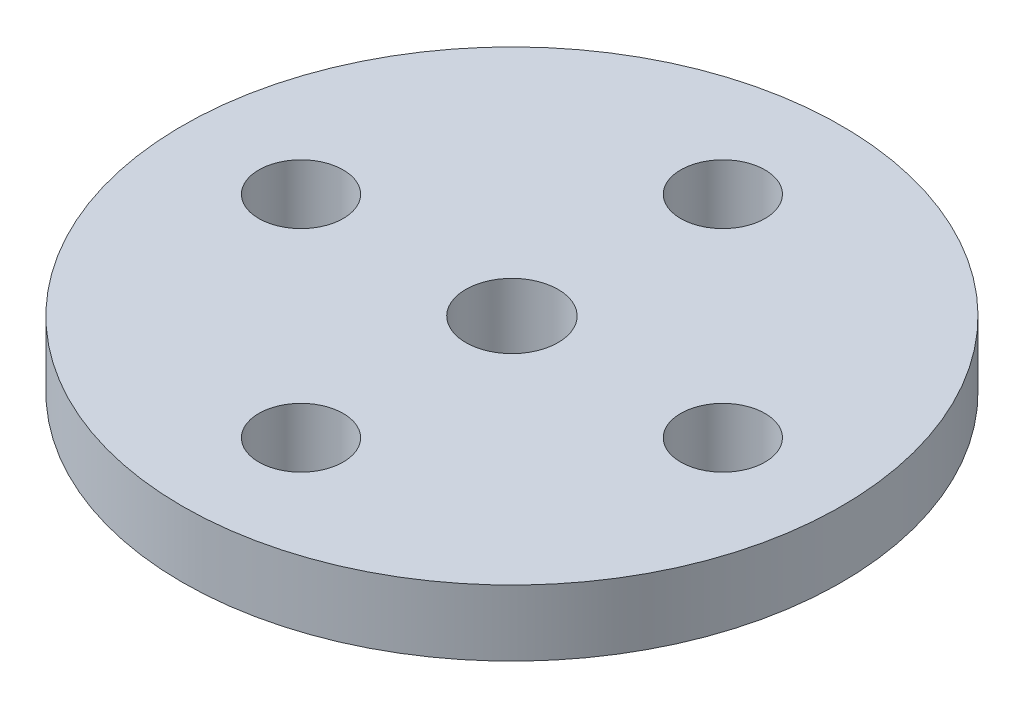
from build123d import *
from build123d.topology import SkipClean

# Parameters (mm, degrees)
CUT_EXTRUDE1_START         = -4.5
CUT_EXTRUDE1_OUTLINE_R     = 6.99
CUT_EXTRUDE1_OUTLINE_R_2   = 3.43154
CUT_EXTRUDE1_DEPTH         = 4.5
CUT_EXTRUDE1_2_OUTLINE_R   = 3.43154
CUT_EXTRUDE1_2_DEPTH       = 2.9
CUT_EXTRUDE1_START_2       = -1.1
CUT_EXTRUDE1_3_OUTLINE_R   = 3.43154
CUT_EXTRUDE1_3_OUTLINE_R_2 = 1.5
CUT_EXTRUDE1_3_DEPTH       = 1.1
SKETCH3_R                  = 1.6
CUT_EXTRUDE2_DEPTH         = 10
SKETCH3_3_R                = 12.5
SKETCH3_3_R_2              = 1.6
BOSS_EXTRUDE1_DEPTH        = 2.5
SKETCH4_R                  = 3
CUT_EXTRUDE3_DEPTH         = 2
SKETCH5_R                  = 1.75
CUT_EXTRUDE4_DEPTH         = 19.241436347
BOSS_EXTRUDE2_START        = 1.5
BOSS_EXTRUDE2_DEPTH        = 1.5
CUT_EXTRUDE5_DEPTH         = 3.5


with BuildPart() as part:
    # Cut-Extrude1: read off the stored shape, not the designer's step
    # Cut-Extrude1 outline → Cut-Extrude1 (new body)
    with BuildSketch(Plane(origin=(0, 4.5, 0), x_dir=(1, 0, 0), z_dir=(0, 1, 0)).offset(CUT_EXTRUDE1_START)):
        Circle(CUT_EXTRUDE1_OUTLINE_R)
        Circle(CUT_EXTRUDE1_OUTLINE_R_2, mode=Mode.SUBTRACT)
    extrude(amount=CUT_EXTRUDE1_DEPTH)

    # Cut-Extrude1 2 outline → Cut-Extrude1 2 (add)
    with BuildSketch(Plane(origin=(0, 4.5, 0), x_dir=(1, 0, 0), z_dir=(0, 1, 0)).offset(CUT_EXTRUDE1_START)):
        Circle(CUT_EXTRUDE1_2_OUTLINE_R)
        with BuildLine():
            ThreePointArc((-2.053246938, -1.675314004), (-2.115398038, -1.596117521), (-2.174496205, -1.514617527))
            Line((-2.174496205, -1.514617527), (-2.614150746, -1.571214778))
            ThreePointArc((-2.614150746, -1.571214778), (-2.645747318, -1.517406053), (-2.676236467, -1.462962191))
            Line((-2.676236467, -1.462962191), (-2.405374061, -1.112059184))
            ThreePointArc((-2.405374061, -1.112059184), (-2.445877205, -1.019894454), (-2.48285047, -0.926257816))
            Line((-2.48285047, -0.926257816), (-2.922767619, -0.871739323))
            ThreePointArc((-2.922767619, -0.871739323), (-2.939989841, -0.81176335), (-2.955981479, -0.751447599))
            Line((-2.955981479, -0.751447599), (-2.606362684, -0.478929596))
            ThreePointArc((-2.606362684, -0.478929596), (-2.622672912, -0.379587668), (-2.635198109, -0.27969792))
            Line((-2.635198109, -0.27969792), (-3.047736253, -0.11748928))
            ThreePointArc((-3.047736253, -0.11748928), (-3.04950199, -0.05511457), (-3.049991304, 0.00728321))
            Line((-3.049991304, 0.00728321), (-2.643583955, 0.1842929))
            ThreePointArc((-2.643583955, 0.1842929), (-2.634676434, 0.284570008), (-2.621966559, 0.384436425))
            Line((-2.621966559, 0.384436425), (-2.98120441, 0.644143047))
            ThreePointArc((-2.98120441, 0.644143047), (-2.967402713, 0.704997262), (-2.952358958, 0.765556388))
            Line((-2.952358958, 0.765556388), (-2.514699123, 0.835935595))
            ThreePointArc((-2.514699123, 0.835935595), (-2.481133546, 0.930847102), (-2.443987207, 1.024415215))
            Line((-2.443987207, 1.024415215), (-2.72735253, 1.365301497))
            ThreePointArc((-2.72735253, 1.365301497), (-2.698850611, 1.420811522), (-2.669219041, 1.475726842))
            Line((-2.669219041, 1.475726842), (-2.227806497, 1.435053382))
            ThreePointArc((-2.227806497, 1.435053382), (-2.171691912, 1.51863565), (-2.11244315, 1.60002623))
            Line((-2.11244315, 1.60002623), (-2.30213106, 2.000673033))
            ThreePointArc((-2.30213106, 2.000673033), (-2.260719799, 2.04735097), (-2.218362274, 2.093171952))
            Line((-2.218362274, 2.093171952), (-1.800932596, 1.944001488))
            ThreePointArc((-1.800932596, 1.944001488), (-1.725794889, 2.011002735), (-1.648166522, 2.075101712))
            Line((-1.648166522, 2.075101712), (-1.732258228, 2.510334924))
            ThreePointArc((-1.732258228, 2.510334924), (-1.680539647, 2.545247826), (-1.628117647, 2.57909537))
            Line((-1.628117647, 2.57909537), (-1.260899476, 2.33080083))
            ThreePointArc((-1.260899476, 2.33080083), (-1.171459825, 2.377011123), (-1.080329529, 2.419790923))
            Line((-1.080329529, 2.419790923), (-1.053541242, 2.862263239))
            ThreePointArc((-1.053541242, 2.862263239), (-0.99476501, 2.8832174), (-0.935572401, 2.90296474))
            Line((-0.935572401, 2.90296474), (-0.641639405, 2.571147385))
            ThreePointArc((-0.641639405, 2.571147385), (-0.543517633, 2.593663159), (-0.444611459, 2.61243577))
            Line((-0.444611459, 2.61243577), (-0.308626384, 3.034345029))
            ThreePointArc((-0.308626384, 3.034345029), (-0.246485627, 3.040023822), (-0.1842417, 3.044430159))
            Line((-0.1842417, 3.044430159), (0.01793723, 2.649939293))
            ThreePointArc((0.01793723, 2.649939293), (0.118575771, 2.6473458), (0.219043185, 2.64093167))
            Line((0.219043185, 2.64093167), (0.455680604, 3.015767761))
            ThreePointArc((0.455680604, 3.015767761), (0.517281353, 3.005814366), (0.578665585, 2.994602835))
            Line((0.578665585, 2.994602835), (0.676386803, 2.562225769))
            ThreePointArc((0.676386803, 2.562225769), (0.773218624, 2.534685969), (0.868934539, 2.50348812))
            Line((0.868934539, 2.50348812), (1.191355504, 2.807698713))
            ThreePointArc((1.191355504, 2.807698713), (1.248545643, 2.782738539), (1.305213182, 2.756613602))
            Line((1.305213182, 2.756613602), (1.292336505, 2.313518178))
            ThreePointArc((1.292336505, 2.313518178), (1.379277306, 2.262762496), (1.464227541, 2.208741205))
            Line((1.464227541, 2.208741205), (1.852173156, 2.423211629))
            ThreePointArc((1.852173156, 2.423211629), (1.901359219, 2.384813015), (1.949749436, 2.345416197))
            Line((1.949749436, 2.345416197), (1.827083952, 1.91944373))
            ThreePointArc((1.827083952, 1.91944373), (1.898670923, 1.848661333), (1.967517741, 1.775210956))
            Line((1.967517741, 1.775210956), (2.396611957, 1.886465246))
            ThreePointArc((2.396611957, 1.886465246), (2.434703403, 1.83704092), (2.471775761, 1.786847667))
            Line((2.471775761, 1.786847667), (2.247028994, 1.404763574))
            ThreePointArc((2.247028994, 1.404763574), (2.298764063, 1.31840198), (2.347181566, 1.230137675))
            Line((2.347181566, 1.230137675), (2.790462815, 1.231185315))
            ThreePointArc((2.790462815, 1.231185315), (2.815066217, 1.173840786), (2.838491325, 1.116004927))
            Line((2.838491325, 1.116004927), (2.525784941, 0.801816956))
            ThreePointArc((2.525784941, 0.801816956), (2.554417403, 0.705302582), (2.57936334, 0.607770319))
            Line((2.57936334, 0.607770319), (3.008978631, 0.498545481))
            ThreePointArc((3.008978631, 0.498545481), (3.018548068, 0.43688392), (3.02685404, 0.375039493))
            Line((3.02685404, 0.375039493), (2.645836531, 0.14848923))
            ThreePointArc((2.645836531, 0.14848923), (2.649567302, 0.047886429), (2.64947423, -0.052785481))
            Line((2.64947423, -0.052785481), (3.038429254, -0.265419798))
            ThreePointArc((3.038429254, -0.265419798), (3.032363443, -0.32752397), (3.025028383, -0.389491052))
            Line((3.025028383, -0.389491052), (2.599640481, -0.51416862))
            ThreePointArc((2.599640481, -0.51416862), (2.578235144, -0.612538605), (2.553108909, -0.710024576))
            Line((2.553108909, -0.710024576), (2.876964192, -1.012707775))
            ThreePointArc((2.876964192, -1.012707775), (2.85564427, -1.071352325), (2.833129068, -1.129548442))
            Line((2.833129068, -1.129548442), (2.390099459, -1.144519366))
            ThreePointArc((2.390099459, -1.144519366), (2.344902989, -1.234475585), (2.296322366, -1.322650214))
            Line((2.296322366, -1.322650214), (2.534728889, -1.696363599))
            ThreePointArc((2.534728889, -1.696363599), (2.499494465, -1.747863673), (2.463213834, -1.798632149))
            Line((2.463213834, -1.798632149), (2.030379697, -1.70295575))
            ThreePointArc((2.030379697, -1.70295575), (1.964231956, -1.778845924), (1.895249444, -1.852168876))
            Line((1.895249444, -1.852168876), (2.033227248, -2.273430658))
            ThreePointArc((2.033227248, -2.273430658), (1.98629223, -2.314550318), (1.938525816, -2.354701183))
            Line((1.938525816, -2.354701183), (1.543083712, -2.154389161))
            ThreePointArc((1.543083712, -2.154389161), (1.460141005, -2.211444832), (1.375091029, -2.265308955))
            Line((1.375091029, -2.265308955), (1.403970461, -2.707649708))
            ThreePointArc((1.403970461, -2.707649708), (1.34828395, -2.735805254), (1.292033091, -2.762815682))
            Line((1.292033091, -2.762815682), (0.958830102, -2.470454378))
            ThreePointArc((0.958830102, -2.470454378), (0.864304025, -2.505090528), (0.768530587, -2.536111342))
            Line((0.768530587, -2.536111342), (0.686497047, -2.971737169))
            ThreePointArc((0.686497047, -2.971737169), (0.625558031, -2.985159485), (0.564357176, -2.99733231))
            Line((0.564357176, -2.99733231), (0.314329671, -2.631291861))
            ThreePointArc((0.314329671, -2.631291861), (0.214159644, -2.641332173), (0.113680542, -2.647560525))
            Line((0.113680542, -2.647560525), (-0.074111501, -3.049099455))
            ThreePointArc((-0.074111501, -3.049099455), (-0.136474001, -3.046945166), (-0.198779377, -3.043515526))
            Line((-0.198779377, -3.043515526), (-0.34992125, -2.626795599))
            ThreePointArc((-0.34992125, -2.626795599), (-0.449441176, -2.611609203), (-0.54831247, -2.592653744))
            Line((-0.54831247, -2.592653744), (-0.830063352, -2.934875608))
            ThreePointArc((-0.830063352, -2.934875608), (-0.889930869, -2.917280077), (-0.94942589, -2.898463469))
            Line((-0.94942589, -2.898463469), (-0.992185331, -2.457248109))
            ThreePointArc((-0.992185331, -2.457248109), (-1.084801952, -2.417789222), (-1.175852992, -2.374840993))
            Line((-1.175852992, -2.374840993), (-1.533859269, -2.636242732))
            ThreePointArc((-1.533859269, -2.636242732), (-1.587470108, -2.604311552), (-1.640416483, -2.571290291))
            Line((-1.640416483, -2.571290291), (-1.57210676, -2.133302683))
            ThreePointArc((-1.57210676, -2.133302683), (-1.652000633, -2.072050653), (-1.729510347, -2.007808248))
            Line((-1.729510347, -2.007808248), (-2.141277167, -2.171965031))
            ThreePointArc((-2.141277167, -2.171965031), (-2.18526276, -2.127704554), (-2.228333675, -2.082553489))
            Line((-2.228333675, -2.082553489), (-2.053246938, -1.675314004))
        make_face(mode=Mode.SUBTRACT)
    extrude(amount=CUT_EXTRUDE1_2_DEPTH)

    # Cut-Extrude1 3 outline → Cut-Extrude1 3 (add)
    with BuildSketch(Plane(origin=(0, 4.5, 0), x_dir=(1, 0, 0), z_dir=(0, 1, 0)).offset(CUT_EXTRUDE1_START_2)):
        Circle(CUT_EXTRUDE1_3_OUTLINE_R)
        Circle(CUT_EXTRUDE1_3_OUTLINE_R_2, mode=Mode.SUBTRACT)
    extrude(amount=CUT_EXTRUDE1_3_DEPTH)

    # Sketch3 → Cut-Extrude2 (cut)
    with BuildSketch(Plane(origin=(0, 4.5, 0), x_dir=(1, 0, 0), z_dir=(0, 1, 0))):
        with Locations((8, 0)):
            Circle(SKETCH3_R)
        with Locations((0, -8)):
            Circle(SKETCH3_R)
        with Locations((-8, 0)):
            Circle(SKETCH3_R)
        with Locations((0, 8)):
            Circle(SKETCH3_R)
    extrude(amount=-CUT_EXTRUDE2_DEPTH, mode=Mode.SUBTRACT)

    # Sketch3<3> → Boss-Extrude1 (add)
    with BuildSketch(Plane(origin=(0, 4.5, 0), x_dir=(1, 0, 0), z_dir=(0, 1, 0))):
        with Locations(Location((0, 0, 0), (0, 0, 270))):
            Circle(SKETCH3_3_R)
        with Locations(Location((8, 0, 0), (0, 0, 270))):
            Circle(SKETCH3_3_R_2, mode=Mode.SUBTRACT)
        with Locations(Location((0, -8, 0), (0, 0, 270))):
            Circle(SKETCH3_3_R_2, mode=Mode.SUBTRACT)
        with Locations(Location((-8, 0, 0), (0, 0, 270))):
            Circle(SKETCH3_3_R_2, mode=Mode.SUBTRACT)
        with Locations(Location((0, 8, 0), (0, 0, 270))):
            Circle(SKETCH3_3_R_2, mode=Mode.SUBTRACT)
    extrude(amount=-BOSS_EXTRUDE1_DEPTH)

    # Sketch4 → Cut-Extrude3 (cut)
    with BuildSketch(Plane.XZ):
        with Locations((0, -8)):
            Circle(SKETCH4_R)
        with Locations((8, 0)):
            Circle(SKETCH4_R)
        with Locations((0, 8)):
            Circle(SKETCH4_R)
        with Locations((-8, 0)):
            Circle(SKETCH4_R)
    extrude(amount=-CUT_EXTRUDE3_DEPTH, mode=Mode.SUBTRACT)

    # Sketch5 → Cut-Extrude4 (cut, through all)
    with BuildSketch(Plane.XZ):
        with Locations(Location((0, 0, 0), (0, 0, 270))):
            Circle(SKETCH5_R)
    extrude(amount=-CUT_EXTRUDE4_DEPTH, mode=Mode.SUBTRACT)

    # Sketch7 → Boss-Extrude2 (add)
    with SkipClean():  # the faces are left unmerged after this step: merging them gives an invalid solid
        with BuildSketch(Plane.XZ.offset(BOSS_EXTRUDE2_START)):
            with BuildLine():
                ThreePointArc((-6.49125625, -2.593008349), (-4.9426764, -4.9426764), (-2.593008349, -6.49125625))
                ThreePointArc((-2.593008349, -6.49125625), (0, -5), (2.593008349, -6.49125625))
                ThreePointArc((2.593008349, -6.49125625), (4.9426764, -4.9426764), (6.49125625, -2.593008349))
                ThreePointArc((6.49125625, -2.593008349), (5, 0), (6.49125625, 2.593008349))
                ThreePointArc((6.49125625, 2.593008349), (4.9426764, 4.9426764), (2.593008349, 6.49125625))
                ThreePointArc((2.593008349, 6.49125625), (0, 5), (-2.593008349, 6.49125625))
                ThreePointArc((-2.593008349, 6.49125625), (-4.9426764, 4.9426764), (-6.49125625, 2.593008349))
                ThreePointArc((-6.49125625, 2.593008349), (-5, 0), (-6.49125625, -2.593008349))
            make_face()
            with BuildLine():
                Line((2.347181566, -1.230137675), (2.790462815, -1.231185315))
                ThreePointArc((2.790462815, -1.231185315), (2.815066217, -1.173840786), (2.838491325, -1.116004927))
                Line((2.838491325, -1.116004927), (2.525784941, -0.801816956))
                ThreePointArc((2.525784941, -0.801816956), (2.554417403, -0.705302582), (2.57936334, -0.607770319))
                Line((2.57936334, -0.607770319), (3.008978631, -0.498545481))
                ThreePointArc((3.008978631, -0.498545481), (3.018548068, -0.43688392), (3.02685404, -0.375039493))
                Line((3.02685404, -0.375039493), (2.645836531, -0.14848923))
                ThreePointArc((2.645836531, -0.14848923), (2.649567302, -0.047886429), (2.64947423, 0.052785481))
                Line((2.64947423, 0.052785481), (3.038429254, 0.265419798))
                ThreePointArc((3.038429254, 0.265419798), (3.032363443, 0.327523971), (3.025028383, 0.389491052))
                Line((3.025028383, 0.389491052), (2.599640481, 0.51416862))
                ThreePointArc((2.599640481, 0.51416862), (2.578235144, 0.612538605), (2.553108909, 0.710024576))
                Line((2.553108909, 0.710024576), (2.876964192, 1.012707775))
                ThreePointArc((2.876964192, 1.012707775), (2.85564427, 1.071352325), (2.833129068, 1.129548442))
                Line((2.833129068, 1.129548442), (2.390099459, 1.144519366))
                ThreePointArc((2.390099459, 1.144519366), (2.344902989, 1.234475585), (2.296322366, 1.322650214))
                Line((2.296322366, 1.322650214), (2.534728889, 1.696363599))
                ThreePointArc((2.534728889, 1.696363599), (2.499494465, 1.747863673), (2.463213834, 1.798632149))
                Line((2.463213834, 1.798632149), (2.030379697, 1.70295575))
                ThreePointArc((2.030379697, 1.70295575), (1.964231956, 1.778845924), (1.895249444, 1.852168876))
                Line((1.895249444, 1.852168876), (2.033227248, 2.273430658))
                ThreePointArc((2.033227248, 2.273430658), (1.98629223, 2.314550318), (1.938525816, 2.354701183))
                Line((1.938525816, 2.354701183), (1.543083712, 2.154389161))
                ThreePointArc((1.543083712, 2.154389161), (1.460141005, 2.211444832), (1.375091029, 2.265308955))
                Line((1.375091029, 2.265308955), (1.403970461, 2.707649708))
                ThreePointArc((1.403970461, 2.707649708), (1.34828395, 2.735805254), (1.292033091, 2.762815682))
                Line((1.292033091, 2.762815682), (0.958830102, 2.470454378))
                ThreePointArc((0.958830102, 2.470454378), (0.864304025, 2.505090528), (0.768530587, 2.536111342))
                Line((0.768530587, 2.536111342), (0.686497047, 2.971737169))
                ThreePointArc((0.686497047, 2.971737169), (0.62555803, 2.985159485), (0.564357176, 2.99733231))
                Line((0.564357176, 2.99733231), (0.314329671, 2.631291861))
                ThreePointArc((0.314329671, 2.631291861), (0.214159644, 2.641332173), (0.113680542, 2.647560525))
                Line((0.113680542, 2.647560525), (-0.074111501, 3.049099455))
                ThreePointArc((-0.074111501, 3.049099455), (-0.136474001, 3.046945166), (-0.198779377, 3.043515526))
                Line((-0.198779377, 3.043515526), (-0.34992125, 2.626795599))
                ThreePointArc((-0.34992125, 2.626795599), (-0.449441175, 2.611609203), (-0.54831247, 2.592653744))
                Line((-0.54831247, 2.592653744), (-0.830063352, 2.934875608))
                ThreePointArc((-0.830063352, 2.934875608), (-0.889930869, 2.917280077), (-0.94942589, 2.898463469))
                Line((-0.94942589, 2.898463469), (-0.992185331, 2.457248109))
                ThreePointArc((-0.992185331, 2.457248109), (-1.084801952, 2.417789222), (-1.175852992, 2.374840993))
                Line((-1.175852992, 2.374840993), (-1.533859269, 2.636242732))
                ThreePointArc((-1.533859269, 2.636242732), (-1.587470107, 2.604311552), (-1.640416483, 2.571290291))
                Line((-1.640416483, 2.571290291), (-1.57210676, 2.133302683))
                ThreePointArc((-1.57210676, 2.133302683), (-1.652000633, 2.072050653), (-1.729510347, 2.007808248))
                Line((-1.729510347, 2.007808248), (-2.141277167, 2.171965031))
                ThreePointArc((-2.141277167, 2.171965031), (-2.185262761, 2.127704553), (-2.228333675, 2.082553489))
                Line((-2.228333675, 2.082553489), (-2.053246938, 1.675314004))
                ThreePointArc((-2.053246938, 1.675314004), (-2.115398039, 1.59611752), (-2.174496205, 1.514617527))
                Line((-2.174496205, 1.514617527), (-2.614150746, 1.571214778))
                ThreePointArc((-2.614150746, 1.571214778), (-2.645747318, 1.517406053), (-2.676236467, 1.462962191))
                Line((-2.676236467, 1.462962191), (-2.405374061, 1.112059184))
                ThreePointArc((-2.405374061, 1.112059184), (-2.445877205, 1.019894454), (-2.48285047, 0.926257816))
                Line((-2.48285047, 0.926257816), (-2.922767619, 0.871739323))
                ThreePointArc((-2.922767619, 0.871739323), (-2.939989841, 0.811763349), (-2.955981479, 0.751447599))
                Line((-2.955981479, 0.751447599), (-2.606362684, 0.478929596))
                ThreePointArc((-2.606362684, 0.478929596), (-2.622672912, 0.379587668), (-2.635198109, 0.27969792))
                Line((-2.635198109, 0.27969792), (-3.047736253, 0.11748928))
                ThreePointArc((-3.047736253, 0.11748928), (-3.04950199, 0.055114569), (-3.049991304, -0.00728321))
                Line((-3.049991304, -0.00728321), (-2.643583955, -0.1842929))
                ThreePointArc((-2.643583955, -0.1842929), (-2.634676434, -0.284570007), (-2.621966559, -0.384436425))
                Line((-2.621966559, -0.384436425), (-2.98120441, -0.644143047))
                ThreePointArc((-2.98120441, -0.644143047), (-2.967402713, -0.704997262), (-2.952358958, -0.765556388))
                Line((-2.952358958, -0.765556388), (-2.514699123, -0.835935595))
                ThreePointArc((-2.514699123, -0.835935595), (-2.481133546, -0.930847102), (-2.443987207, -1.024415215))
                Line((-2.443987207, -1.024415215), (-2.72735253, -1.365301497))
                ThreePointArc((-2.72735253, -1.365301497), (-2.698850611, -1.420811522), (-2.669219041, -1.475726842))
                Line((-2.669219041, -1.475726842), (-2.227806497, -1.435053382))
                ThreePointArc((-2.227806497, -1.435053382), (-2.171691912, -1.51863565), (-2.11244315, -1.60002623))
                Line((-2.11244315, -1.60002623), (-2.30213106, -2.000673033))
                ThreePointArc((-2.30213106, -2.000673033), (-2.260719799, -2.04735097), (-2.218362274, -2.093171952))
                Line((-2.218362274, -2.093171952), (-1.800932596, -1.944001488))
                ThreePointArc((-1.800932596, -1.944001488), (-1.725794889, -2.011002735), (-1.648166522, -2.075101712))
                Line((-1.648166522, -2.075101712), (-1.732258228, -2.510334924))
                ThreePointArc((-1.732258228, -2.510334924), (-1.680539647, -2.545247826), (-1.628117647, -2.57909537))
                Line((-1.628117647, -2.57909537), (-1.260899476, -2.33080083))
                ThreePointArc((-1.260899476, -2.33080083), (-1.171459825, -2.377011123), (-1.080329529, -2.419790923))
                Line((-1.080329529, -2.419790923), (-1.053541242, -2.862263239))
                ThreePointArc((-1.053541242, -2.862263239), (-0.994765009, -2.8832174), (-0.935572401, -2.90296474))
                Line((-0.935572401, -2.90296474), (-0.641639405, -2.571147385))
                ThreePointArc((-0.641639405, -2.571147385), (-0.543517633, -2.593663159), (-0.444611459, -2.61243577))
                Line((-0.444611459, -2.61243577), (-0.308626384, -3.034345029))
                ThreePointArc((-0.308626384, -3.034345029), (-0.246485628, -3.040023822), (-0.1842417, -3.044430159))
                Line((-0.1842417, -3.044430159), (0.01793723, -2.649939293))
                ThreePointArc((0.01793723, -2.649939293), (0.118575771, -2.6473458), (0.219043185, -2.64093167))
                Line((0.219043185, -2.64093167), (0.455680604, -3.015767761))
                ThreePointArc((0.455680604, -3.015767761), (0.517281353, -3.005814366), (0.578665585, -2.994602835))
                Line((0.578665585, -2.994602835), (0.676386803, -2.562225769))
                ThreePointArc((0.676386803, -2.562225769), (0.773218624, -2.534685969), (0.868934539, -2.50348812))
                Line((0.868934539, -2.50348812), (1.191355504, -2.807698713))
                ThreePointArc((1.191355504, -2.807698713), (1.248545643, -2.782738539), (1.305213182, -2.756613602))
                Line((1.305213182, -2.756613602), (1.292336505, -2.313518178))
                ThreePointArc((1.292336505, -2.313518178), (1.379277306, -2.262762496), (1.464227541, -2.208741205))
                Line((1.464227541, -2.208741205), (1.852173156, -2.423211629))
                ThreePointArc((1.852173156, -2.423211629), (1.901359219, -2.384813015), (1.949749436, -2.345416197))
                Line((1.949749436, -2.345416197), (1.827083952, -1.91944373))
                ThreePointArc((1.827083952, -1.91944373), (1.898670923, -1.848661333), (1.967517741, -1.775210956))
                Line((1.967517741, -1.775210956), (2.396611957, -1.886465246))
                ThreePointArc((2.396611957, -1.886465246), (2.434703403, -1.83704092), (2.471775761, -1.786847667))
                Line((2.471775761, -1.786847667), (2.247028994, -1.404763574))
                ThreePointArc((2.247028994, -1.404763574), (2.298764063, -1.31840198), (2.347181566, -1.230137675))
            make_face(mode=Mode.SUBTRACT)
        extrude(amount=-BOSS_EXTRUDE2_DEPTH)

    # Sketch8 → Cut-Extrude5 (cut)
    with SkipClean():  # the faces are left unmerged after this step: merging them gives an invalid solid
        with BuildSketch(Plane.XZ.offset(1.5)):
            with BuildLine():
                Line((-0.034211258, -3.29982266), (0.133172039, -2.97322492))
                Line((0.133172039, -2.97322492), (0.32908341, -3.283550534))
                ThreePointArc((0.32908341, -3.283550534), (0.559681464, -3.252192593), (0.787496077, -3.204660657))
                Line((0.787496077, -3.204660657), (0.868399164, -2.846697052))
                Line((0.868399164, -2.846697052), (1.135330461, -3.09855204))
                ThreePointArc((1.135330461, -3.09855204), (1.35088545, -3.010831862), (1.559722137, -2.908138039))
                Line((1.559722137, -2.908138039), (1.549061576, -2.541300739))
                Line((1.549061576, -2.541300739), (1.870240524, -2.718860125))
                ThreePointArc((1.870240524, -2.718860125), (2.057208336, -2.580289492), (2.233945119, -2.428886413))
                Line((2.233945119, -2.428886413), (2.132390753, -2.076225155))
                Line((2.132390753, -2.076225155), (2.487636497, -2.16833223))
                ThreePointArc((2.487636497, -2.16833223), (2.634269256, -1.987618044), (2.767801113, -1.79701892))
                Line((2.767801113, -1.79701892), (2.581733975, -1.480692708))
                Line((2.581733975, -1.480692708), (2.948725119, -1.481560046))
                ThreePointArc((2.948725119, -1.481560046), (3.04580935, -1.270057244), (3.127745984, -1.05223812))
                Line((3.127745984, -1.05223812), (2.868857358, -0.792122893))
                Line((2.868857358, -0.792122893), (3.224534498, -0.701695995))
                ThreePointArc((3.224534498, -0.701695995), (3.265970041, -0.472694077), (3.291163071, -0.241341329))
                Line((3.291163071, -0.241341329), (2.975719881, -0.053781083))
                Line((2.975719881, -0.053781083), (3.297734515, 0.122258195))
                ThreePointArc((3.297734515, 0.122258195), (3.280917823, 0.354370198), (3.247784279, 0.584719826))
                Line((3.247784279, 0.584719826), (2.89560698, 0.68793999))
                Line((2.89560698, 0.68793999), (3.163725745, 0.938530454))
                ThreePointArc((3.163725745, 0.938530454), (3.089713472, 1.15916809), (3.000335256, 1.374040883))
                Line((3.000335256, 1.374040883), (2.633552444, 1.386435263))
                Line((2.633552444, 1.386435263), (2.83092845, 1.695831392))
                ThreePointArc((2.83092845, 1.695831392), (2.70437106, 1.891131187), (2.564364135, 2.077025899))
                Line((2.564364135, 2.077025899), (2.206022122, 1.99781571))
                Line((2.206022122, 1.99781571), (2.32025351, 2.346577007))
                ThreePointArc((2.32025351, 2.346577007), (2.149103069, 2.504267557), (1.967264584, 2.649503738))
                Line((1.967264584, 2.649503738), (1.639879317, 2.483666049))
                Line((1.639879317, 2.483666049), (1.663788508, 2.849878559))
                ThreePointArc((1.663788508, 2.849878559), (1.458799028, 2.960051587), (1.246554564, 3.055503513))
                Line((1.246554564, 3.055503513), (0.970696863, 2.813458515))
                Line((0.970696863, 2.813458515), (0.902781555, 3.17411176))
                ThreePointArc((0.902781555, 3.17411176), (0.676833279, 3.229844689), (0.447518936, 3.269514766))
                Line((0.447518936, 3.269514766), (0.240521956, 2.966471035))
                Line((0.240521956, 2.966471035), (0.085049517, 3.298903845))
                ThreePointArc((0.085049517, 3.298903845), (-0.147660394, 3.29669477), (-0.379635953, 3.278090381))
                Line((-0.379635953, 3.278090381), (-0.504765831, 2.933089271))
                Line((-0.504765831, 2.933089271), (-0.738026495, 3.216413669))
                ThreePointArc((-0.738026495, 3.216413669), (-0.962876022, 3.156401395), (-1.182936918, 3.080691521))
                Line((-1.182936918, 3.080691521), (-1.218337324, 2.71541072))
                Line((-1.218337324, 2.71541072), (-1.514729588, 2.931824394))
                ThreePointArc((-1.514729588, 2.931824394), (-1.717590608, 2.817779712), (-1.911909606, 2.689721483))
                Line((-1.911909606, 2.689721483), (-1.855356202, 2.327112928))
                Line((-1.855356202, 2.327112928), (-2.19625665, 2.463017809))
                ThreePointArc((-2.19625665, 2.463017809), (-2.364382659, 2.302106566), (-2.520749982, 2.129746353))
                Line((-2.520749982, 2.129746353), (-2.375796227, 1.792594071))
                Line((-2.375796227, 1.792594071), (-2.73978483, 1.839450757))
                ThreePointArc((-2.73978483, 1.839450757), (-2.862611852, 1.641783598), (-2.971202366, 1.435951426))
                Line((-2.971202366, 1.435951426), (-2.746956237, 1.145439937))
                Line((-2.746956237, 1.145439937), (-3.111162252, 1.100304248))
                ThreePointArc((-3.111162252, 1.100304248), (-3.180972615, 0.878301329), (-3.234963179, 0.65193039))
                Line((-3.234963179, 0.65193039), (-2.945514884, 0.426313598))
                Line((-2.945514884, 0.426313598), (-3.287053909, 0.292021578))
                ThreePointArc((-3.287053909, 0.292021578), (-3.299461169, 0.059632157), (-3.295459357, -0.17305383))
                Line((-3.295459357, -0.17305383), (-2.958995998, -0.319599592))
                Line((-2.958995998, -0.319599592), (-3.256407879, -0.534609883))
                ThreePointArc((-3.256407879, -0.534609883), (-3.210632444, -0.762783923), (-3.148889704, -0.987164441))
                Line((-3.148889704, -0.987164441), (-2.786552511, -1.045431164))
                Line((-2.786552511, -1.045431164), (-3.021149766, -1.327649838))
                ThreePointArc((-3.021149766, -1.327649838), (-2.920067874, -1.537271483), (-2.80446373, -1.73924788))
                Line((-2.80446373, -1.73924788), (-2.439019682, -1.705574451))
                Line((-2.439019682, -1.705574451), (-2.596061702, -2.037268672))
                ThreePointArc((-2.596061702, -2.037268672), (-2.4460247, -2.215166623), (-2.283822986, -2.382047978))
                Line((-2.283822986, -2.382047978), (-1.938234276, -2.258550223))
                Line((-1.938234276, -2.258550223), (-2.007853534, -2.618878422))
                ThreePointArc((-2.007853534, -2.618878422), (-1.818288799, -2.753874697), (-1.619681244, -2.875175241))
                Line((-1.619681244, -2.875175241), (-1.315662482, -2.669612977))
                Line((-1.315662482, -2.669612977), (-1.293484543, -3.035934409))
                ThreePointArc((-1.293484543, -3.035934409), (-1.076303125, -3.119546695), (-0.853768973, -3.18764467))
                Line((-0.853768973, -3.18764467), (-0.610422775, -2.912934131))
                Line((-0.610422775, -2.912934131), (-0.497841162, -3.262231472))
                ThreePointArc((-0.497841162, -3.262231472), (-0.266689368, -3.289206102), (-0.034211258, -3.29982266))
            make_face()
            with BuildLine():
                Line((2.838491325, -1.116004927), (2.525784941, -0.801816956))
                ThreePointArc((2.525784941, -0.801816956), (2.554417403, -0.705302582), (2.57936334, -0.607770319))
                Line((2.57936334, -0.607770319), (3.008978631, -0.498545481))
                ThreePointArc((3.008978631, -0.498545481), (3.018548068, -0.43688392), (3.02685404, -0.375039493))
                Line((3.02685404, -0.375039493), (2.645836531, -0.14848923))
                ThreePointArc((2.645836531, -0.14848923), (2.649567302, -0.047886429), (2.64947423, 0.052785481))
                Line((2.64947423, 0.052785481), (3.038429254, 0.265419798))
                ThreePointArc((3.038429254, 0.265419798), (3.032363443, 0.327523971), (3.025028383, 0.389491052))
                Line((3.025028383, 0.389491052), (2.599640481, 0.51416862))
                ThreePointArc((2.599640481, 0.51416862), (2.578235144, 0.612538605), (2.553108909, 0.710024576))
                Line((2.553108909, 0.710024576), (2.876964192, 1.012707775))
                ThreePointArc((2.876964192, 1.012707775), (2.85564427, 1.071352325), (2.833129068, 1.129548442))
                Line((2.833129068, 1.129548442), (2.390099459, 1.144519366))
                ThreePointArc((2.390099459, 1.144519366), (2.344902989, 1.234475585), (2.296322366, 1.322650214))
                Line((2.296322366, 1.322650214), (2.534728889, 1.696363599))
                ThreePointArc((2.534728889, 1.696363599), (2.499494465, 1.747863673), (2.463213834, 1.798632149))
                Line((2.463213834, 1.798632149), (2.030379697, 1.70295575))
                ThreePointArc((2.030379697, 1.70295575), (1.964231956, 1.778845924), (1.895249444, 1.852168876))
                Line((1.895249444, 1.852168876), (2.033227248, 2.273430658))
                ThreePointArc((2.033227248, 2.273430658), (1.98629223, 2.314550318), (1.938525816, 2.354701183))
                Line((1.938525816, 2.354701183), (1.543083712, 2.154389161))
                ThreePointArc((1.543083712, 2.154389161), (1.460141005, 2.211444832), (1.375091029, 2.265308955))
                Line((1.375091029, 2.265308955), (1.403970461, 2.707649708))
                ThreePointArc((1.403970461, 2.707649708), (1.34828395, 2.735805254), (1.292033091, 2.762815682))
                Line((1.292033091, 2.762815682), (0.958830102, 2.470454378))
                ThreePointArc((0.958830102, 2.470454378), (0.864304025, 2.505090528), (0.768530587, 2.536111342))
                Line((0.768530587, 2.536111342), (0.686497047, 2.971737169))
                ThreePointArc((0.686497047, 2.971737169), (0.62555803, 2.985159485), (0.564357176, 2.99733231))
                Line((0.564357176, 2.99733231), (0.314329671, 2.631291861))
                ThreePointArc((0.314329671, 2.631291861), (0.214159644, 2.641332173), (0.113680542, 2.647560525))
                Line((0.113680542, 2.647560525), (-0.074111501, 3.049099455))
                ThreePointArc((-0.074111501, 3.049099455), (-0.136474001, 3.046945166), (-0.198779377, 3.043515526))
                Line((-0.198779377, 3.043515526), (-0.34992125, 2.626795599))
                ThreePointArc((-0.34992125, 2.626795599), (-0.449441175, 2.611609203), (-0.54831247, 2.592653744))
                Line((-0.54831247, 2.592653744), (-0.830063352, 2.934875608))
                ThreePointArc((-0.830063352, 2.934875608), (-0.889930869, 2.917280077), (-0.94942589, 2.898463469))
                Line((-0.94942589, 2.898463469), (-0.992185331, 2.457248109))
                ThreePointArc((-0.992185331, 2.457248109), (-1.084801952, 2.417789222), (-1.175852992, 2.374840993))
                Line((-1.175852992, 2.374840993), (-1.533859269, 2.636242732))
                ThreePointArc((-1.533859269, 2.636242732), (-1.587470107, 2.604311552), (-1.640416483, 2.571290291))
                Line((-1.640416483, 2.571290291), (-1.57210676, 2.133302683))
                ThreePointArc((-1.57210676, 2.133302683), (-1.652000633, 2.072050653), (-1.729510347, 2.007808248))
                Line((-1.729510347, 2.007808248), (-2.141277167, 2.171965031))
                ThreePointArc((-2.141277167, 2.171965031), (-2.185262761, 2.127704553), (-2.228333675, 2.082553489))
                Line((-2.228333675, 2.082553489), (-2.053246938, 1.675314004))
                ThreePointArc((-2.053246938, 1.675314004), (-2.115398039, 1.59611752), (-2.174496205, 1.514617527))
                Line((-2.174496205, 1.514617527), (-2.614150746, 1.571214778))
                ThreePointArc((-2.614150746, 1.571214778), (-2.645747318, 1.517406053), (-2.676236467, 1.462962191))
                Line((-2.676236467, 1.462962191), (-2.405374061, 1.112059184))
                ThreePointArc((-2.405374061, 1.112059184), (-2.445877205, 1.019894454), (-2.48285047, 0.926257816))
                Line((-2.48285047, 0.926257816), (-2.922767619, 0.871739323))
                ThreePointArc((-2.922767619, 0.871739323), (-2.939989841, 0.811763349), (-2.955981479, 0.751447599))
                Line((-2.955981479, 0.751447599), (-2.606362684, 0.478929596))
                ThreePointArc((-2.606362684, 0.478929596), (-2.622672912, 0.379587668), (-2.635198109, 0.27969792))
                Line((-2.635198109, 0.27969792), (-3.047736253, 0.11748928))
                ThreePointArc((-3.047736253, 0.11748928), (-3.04950199, 0.055114569), (-3.049991304, -0.00728321))
                Line((-3.049991304, -0.00728321), (-2.643583955, -0.1842929))
                ThreePointArc((-2.643583955, -0.1842929), (-2.634676434, -0.284570007), (-2.621966559, -0.384436425))
                Line((-2.621966559, -0.384436425), (-2.98120441, -0.644143047))
                ThreePointArc((-2.98120441, -0.644143047), (-2.967402713, -0.704997262), (-2.952358958, -0.765556388))
                Line((-2.952358958, -0.765556388), (-2.514699123, -0.835935595))
                ThreePointArc((-2.514699123, -0.835935595), (-2.481133546, -0.930847102), (-2.443987207, -1.024415215))
                Line((-2.443987207, -1.024415215), (-2.72735253, -1.365301497))
                ThreePointArc((-2.72735253, -1.365301497), (-2.698850611, -1.420811522), (-2.669219041, -1.475726842))
                Line((-2.669219041, -1.475726842), (-2.227806497, -1.435053382))
                ThreePointArc((-2.227806497, -1.435053382), (-2.171691912, -1.51863565), (-2.11244315, -1.60002623))
                Line((-2.11244315, -1.60002623), (-2.30213106, -2.000673033))
                ThreePointArc((-2.30213106, -2.000673033), (-2.260719799, -2.04735097), (-2.218362274, -2.093171952))
                Line((-2.218362274, -2.093171952), (-1.800932596, -1.944001488))
                ThreePointArc((-1.800932596, -1.944001488), (-1.725794889, -2.011002735), (-1.648166522, -2.075101712))
                Line((-1.648166522, -2.075101712), (-1.732258228, -2.510334924))
                ThreePointArc((-1.732258228, -2.510334924), (-1.680539647, -2.545247826), (-1.628117647, -2.57909537))
                Line((-1.628117647, -2.57909537), (-1.260899476, -2.33080083))
                ThreePointArc((-1.260899476, -2.33080083), (-1.171459825, -2.377011123), (-1.080329529, -2.419790923))
                Line((-1.080329529, -2.419790923), (-1.053541242, -2.862263239))
                ThreePointArc((-1.053541242, -2.862263239), (-0.994765009, -2.8832174), (-0.935572401, -2.90296474))
                Line((-0.935572401, -2.90296474), (-0.641639405, -2.571147385))
                ThreePointArc((-0.641639405, -2.571147385), (-0.543517633, -2.593663159), (-0.444611459, -2.61243577))
                Line((-0.444611459, -2.61243577), (-0.308626384, -3.034345029))
                ThreePointArc((-0.308626384, -3.034345029), (-0.246485628, -3.040023822), (-0.1842417, -3.044430159))
                Line((-0.1842417, -3.044430159), (0.01793723, -2.649939293))
                ThreePointArc((0.01793723, -2.649939293), (0.118575771, -2.6473458), (0.219043185, -2.64093167))
                Line((0.219043185, -2.64093167), (0.455680604, -3.015767761))
                ThreePointArc((0.455680604, -3.015767761), (0.517281353, -3.005814366), (0.578665585, -2.994602835))
                Line((0.578665585, -2.994602835), (0.676386803, -2.562225769))
                ThreePointArc((0.676386803, -2.562225769), (0.773218624, -2.534685969), (0.868934539, -2.50348812))
                Line((0.868934539, -2.50348812), (1.191355504, -2.807698713))
                ThreePointArc((1.191355504, -2.807698713), (1.248545643, -2.782738539), (1.305213182, -2.756613602))
                Line((1.305213182, -2.756613602), (1.292336505, -2.313518178))
                ThreePointArc((1.292336505, -2.313518178), (1.379277306, -2.262762496), (1.464227541, -2.208741205))
                Line((1.464227541, -2.208741205), (1.852173156, -2.423211629))
                ThreePointArc((1.852173156, -2.423211629), (1.901359219, -2.384813015), (1.949749436, -2.345416197))
                Line((1.949749436, -2.345416197), (1.827083952, -1.91944373))
                ThreePointArc((1.827083952, -1.91944373), (1.898670923, -1.848661333), (1.967517741, -1.775210956))
                Line((1.967517741, -1.775210956), (2.396611957, -1.886465246))
                ThreePointArc((2.396611957, -1.886465246), (2.434703403, -1.83704092), (2.471775761, -1.786847667))
                Line((2.471775761, -1.786847667), (2.247028994, -1.404763574))
                ThreePointArc((2.247028994, -1.404763574), (2.298764063, -1.31840198), (2.347181566, -1.230137675))
                Line((2.347181566, -1.230137675), (2.790462815, -1.231185315))
                ThreePointArc((2.790462815, -1.231185315), (2.815066217, -1.173840786), (2.838491325, -1.116004927))
            make_face(mode=Mode.SUBTRACT)
        extrude(amount=-CUT_EXTRUDE5_DEPTH, mode=Mode.SUBTRACT)


solid = part.part
